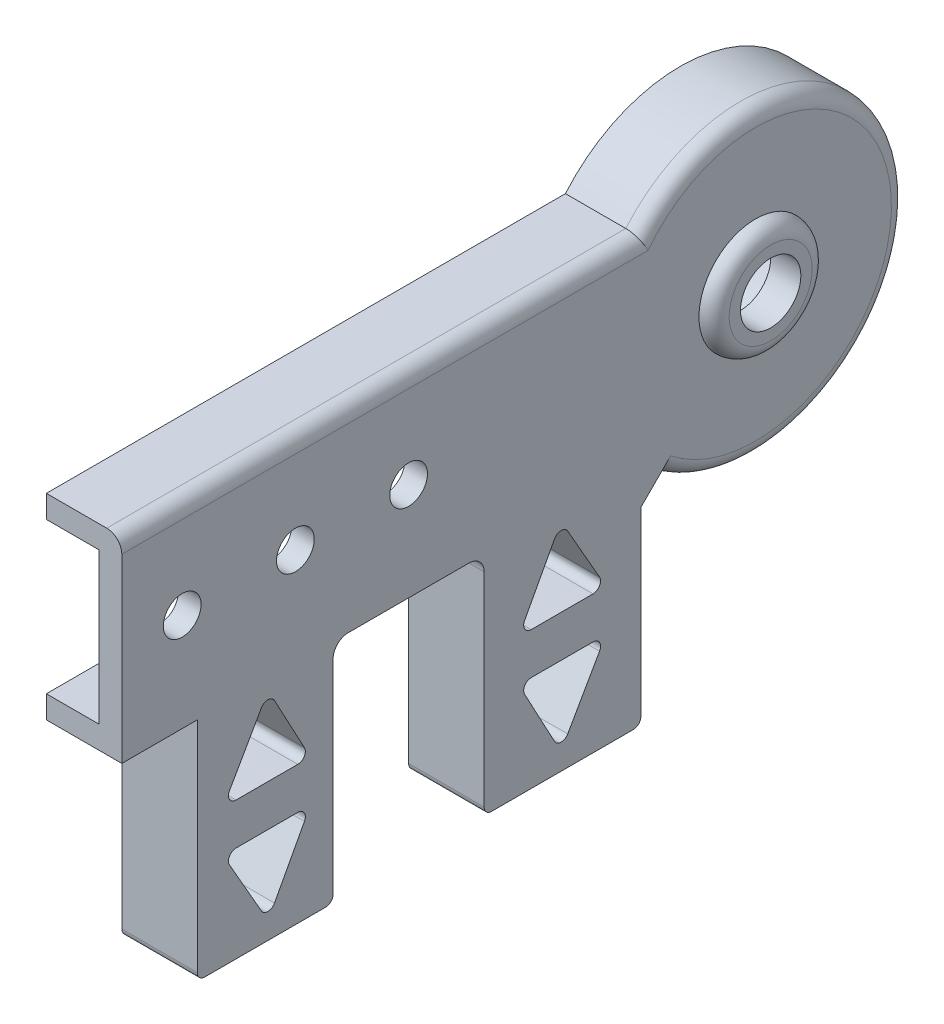
from build123d import *

# Parameters (mm, degrees)
SKETCH_1_R           = 20
SKETCH_1_W           = 63.973509934
SKETCH_1_H           = 26
EXTRUDE_1_DEPTH      = 10
SKETCH_2_W           = 45
SKETCH_2_H           = 20
CUT_EXTRUDE_1_DEPTH  = 7
SKETCH_3_R           = 10
CUT_EXTRUDE_2_DEPTH  = 8
SKETCH_4_R           = 4
CUT_EXTRUDE_3_DEPTH  = 7
SKETCH_6_W           = 10
SKETCH_6_H           = 8
EXTRUDE_2_DEPTH      = 15
CHAMFER_2_SIZE       = 5
EXTRUDE_3_DEPTH      = 20
SKETCH_8_W           = 10
SKETCH_8_H           = 12.77482578
EXTRUDE_4_DEPTH      = 15
SKETCH_9_W           = 7
SKETCH_9_H           = 20
EXTRUDE_5_DEPTH      = 10
SKETCH_10_W          = 7
SKETCH_10_H          = 20
EXTRUDE_6_DEPTH      = 7
SKETCH_11_W          = 10
SKETCH_11_H          = 15
CUT_EXTRUDE_5_DEPTH  = 60.88841868
SKETCH_12_R          = 10
SKETCH_12_W          = 48
SKETCH_12_H          = 20
EXTRUDE_7_DEPTH      = 10
SKETCH_13_R          = 10
CUT_EXTRUDE_6_DEPTH  = 8
SKETCH_14_R          = 4
CUT_EXTRUDE_7_DEPTH  = 8
SKETCH_15_W          = 48
SKETCH_15_H          = 20
CUT_EXTRUDE_8_DEPTH  = 7
SKETCH_16_W          = 10
SKETCH_16_H          = 18
SKETCH_16_H_2        = 20.77482578
EXTRUDE_8_DEPTH      = 15
CUT_EXTRUDE_9_DEPTH  = 15
FILLET_1_R           = 1
FILLET_2_R           = 2
SKETCH_18_R          = 7.5
SKETCH_18_R_2        = 4
EXTRUDE_9_DEPTH      = 2
FILLET_3_R           = 2
SKETCH_19_R          = 2.5
CUT_EXTRUDE_10_DEPTH = 3


# Some blends are built 0.0001 mm under size
with BuildPart() as part:
    # 草图1 → 凸台-拉伸1 (new body)
    with BuildSketch(Plane(origin=(0, 0, 0), x_dir=(0, 0, -1), z_dir=(1, 0, 0))):
        with Locations((31.986754967, 0)):
            Circle(SKETCH_1_R)
        Rectangle(SKETCH_1_W, SKETCH_1_H)
    extrude(amount=EXTRUDE_1_DEPTH)

    # 草图2 → 切除-拉伸1 (cut)
    with BuildSketch(Plane(origin=(10, 0, 0), x_dir=(0, 0, -1), z_dir=(1, 0, 0))):
        with Locations((-9.486754967, 0)):
            Rectangle(SKETCH_2_W, SKETCH_2_H)
    extrude(amount=-CUT_EXTRUDE_1_DEPTH, mode=Mode.SUBTRACT)

    # 草图3 → 切除-拉伸2 (cut)
    with BuildSketch(Plane(origin=(10, 0, 0), x_dir=(0, 0, -1), z_dir=(1, 0, 0))):
        with Locations((31.986754967, 0)):
            Circle(SKETCH_3_R)
    extrude(amount=-CUT_EXTRUDE_2_DEPTH, mode=Mode.SUBTRACT)

    # 草图4 → 切除-拉伸3 (cut)
    with BuildSketch(Plane(origin=(2, 0, 0), x_dir=(0, 0, -1), z_dir=(1, 0, 0))):
        with Locations((31.986754967, 0)):
            Circle(SKETCH_4_R)
    extrude(amount=-CUT_EXTRUDE_3_DEPTH, mode=Mode.SUBTRACT)

    # 草图6 → 凸台-拉伸2 (add)
    with BuildSketch(Plane.XZ.offset(13)):
        with Locations((5, -12.788070813)):
            Rectangle(SKETCH_6_W, SKETCH_6_H)
        with Locations((5, 27.986754967)):
            Rectangle(SKETCH_6_W, SKETCH_6_H)
    extrude(amount=EXTRUDE_2_DEPTH)

    # 倒角2
    # the kernel refuses this chamfer: 5, 3.546264764 mm, written as the material it adds along each edge
    with BuildSketch(Plane(origin=(10, -13, -16.788070813), x_dir=(0, -0.6995038411281902, -0.7146288381019251), z_dir=(-1, 0, 0))) as chamfer_2_piece_1:
        with BuildLine():
            Line((3.535736125, 0), (CHAMFER_2_SIZE * 0.699503841128, CHAMFER_2_SIZE * 0.714628838102))
            Line((CHAMFER_2_SIZE * 0.699503841128, CHAMFER_2_SIZE * 0.714628838102), (0, 0))
            ThreePointArc((0, 0), (1.768947181, 0.07828713), (3.535736125, 0))
        make_face()
    extrude(amount=10)

    # 草图7 → 凸台-拉伸3 (add)
    with BuildSketch(Plane.XY.offset(31.986754967)):
        Polygon((3, -10), (3, 10), (10, 10), (10, 13), (0, 13), (0, -28), (10, -28), (10, -10), align=None)
    extrude(amount=EXTRUDE_3_DEPTH)

    # 草图8 → 凸台-拉伸4 (add)
    with BuildSketch(Plane.XZ.offset(13)):
        with Locations((5, -2.400657923)):
            Rectangle(SKETCH_8_W, SKETCH_8_H)
    extrude(amount=EXTRUDE_4_DEPTH)

    # 草图9 → 凸台-拉伸5 (add)
    with BuildSketch(Plane.XY.offset(-13.013245033)):
        with Locations((6.5, 0)):
            Rectangle(SKETCH_9_W, SKETCH_9_H)
    extrude(amount=EXTRUDE_5_DEPTH)

    # 草图10 → 凸台-拉伸6 (add)
    with BuildSketch(Plane.XY.offset(-3.013245033)):
        with Locations((6.5, 0)):
            Rectangle(SKETCH_10_W, SKETCH_10_H)
    extrude(amount=EXTRUDE_6_DEPTH)

    # 草图11 → 切除-拉伸5 (cut, through all)
    with BuildSketch(Plane(origin=(10, 0, 0), x_dir=(0, 0, -1), z_dir=(1, 0, 0))):
        with Locations((-46.986754967, -20.5)):
            Rectangle(SKETCH_11_W, SKETCH_11_H)
    extrude(amount=-CUT_EXTRUDE_5_DEPTH, mode=Mode.SUBTRACT)

    # 草图12 → 凸台-拉伸7 (add)
    with BuildSketch(Plane(origin=(10, 0, 0), x_dir=(0, 0, -1), z_dir=(1, 0, 0))):
        with Locations((31.986754967, 0)):
            Circle(SKETCH_12_R)
        with Locations((-27.986754967, 0)):
            Rectangle(SKETCH_12_W, SKETCH_12_H)
    extrude(amount=-EXTRUDE_7_DEPTH)

    # 草图13 → 切除-拉伸6 (cut)
    with BuildSketch(Plane.ZY):
        with Locations((-31.986754967, 0)):
            Circle(SKETCH_13_R)
    extrude(amount=-CUT_EXTRUDE_6_DEPTH, mode=Mode.SUBTRACT)

    # 草图14 → 切除-拉伸7 (cut)
    with BuildSketch(Plane.ZY.offset(-8)):
        with Locations((-31.986754967, 0)):
            Circle(SKETCH_14_R)
    extrude(amount=-CUT_EXTRUDE_7_DEPTH, mode=Mode.SUBTRACT)

    # 草图15 → 切除-拉伸8 (cut)
    with BuildSketch(Plane.ZY):
        with Locations((27.986754967, 0)):
            Rectangle(SKETCH_15_W, SKETCH_15_H)
    extrude(amount=-CUT_EXTRUDE_8_DEPTH, mode=Mode.SUBTRACT)

    # 草图16 → 凸台-拉伸8 (add)
    with BuildSketch(Plane.XZ.offset(28)):
        with Locations((5, 32.986754967)):
            Rectangle(SKETCH_16_W, SKETCH_16_H)
        with Locations((5, -6.400657923)):
            Rectangle(SKETCH_16_W, SKETCH_16_H_2)
    extrude(amount=EXTRUDE_8_DEPTH)

    # 草图17 → 切除-拉伸9 (cut)
    with BuildSketch(Plane.ZY):
        Polygon((-0.590983184, -30.271873826), (-12.170144499, -30.271873826), (-6.199884933, -40.719828065), align=None)
        Polygon((-6.199884933, -14.312910757), (-0.590983184, -24.760864996), (-12.170144499, -24.760864996), align=None)
        Polygon((26.997900492, -24.760864996), (38.577061807, -24.760864996), (32.606802242, -14.312910757), align=None)
        Polygon((32.606802242, -40.719828065), (26.997900492, -30.271873826), (38.577061807, -30.271873826), align=None)
    extrude(amount=-CUT_EXTRUDE_9_DEPTH, mode=Mode.SUBTRACT)

    # 圆角1
    fillet_1_edges = [part.edges().sort_by_distance(p)[0] for p in [
        (5, -43, 41.986754967),
        (5, -43, 23.986754967),
        (5, -43, 3.986754967),
        (5, -43, -16.788070813),
        (5, -30.271873826, 38.577061807),
        (5, -40.719828065, 32.606802242),
        (5, -30.271873826, 26.997900492),
        (5, -24.760864996, 26.997900492),
        (5, -14.312910757, 32.606802242),
        (5, -24.760864996, 38.577061807),
        (5, -24.760864996, -12.170144499),
        (5, -14.312910757, -6.199884933),
        (5, -24.760864996, -0.590983184),
        (5, -30.271873826, -0.590983184),
        (5, -40.719828065, -6.199884933),
        (5, -30.271873826, -12.170144499),
    ]]
    fillet(fillet_1_edges, radius=FILLET_1_R)

    # 圆角2
    fillet_2_edges = [part.edges().sort_by_distance(p)[0] for p in [
        (5, -13, 3.986754967),
        (10, 13, 17.599342077),
        (5, -13, 23.986754967),
        (10, 1.767868063, -51.908467808),
    ]]
    fillet(fillet_2_edges, radius=FILLET_2_R)

    # 草图18 → 凸台-拉伸9 (add)
    with BuildSketch(Plane(origin=(10, 0, 0), x_dir=(0, 0, -1), z_dir=(1, 0, 0))):
        with Locations((31.986754967, 0)):
            Circle(SKETCH_18_R)
        with Locations(Location((31.986754967, 0, 0), (0, 0, 180))):
            Circle(SKETCH_18_R_2, mode=Mode.SUBTRACT)
    extrude(amount=EXTRUDE_9_DEPTH)

    # 圆角3
    fillet_3_edges = [part.edges().sort_by_distance(p)[0] for p in [
        (12, 0, -24.486754967),
    ]]
    fillet(fillet_3_edges, radius=FILLET_3_R - 0.0001)  # a hair under: the kernel refuses the full size

    # 草图19 → 切除-拉伸10 (cut)
    with BuildSketch(Plane.ZY.offset(-7)):
        with Locations((43.986754967, 0)):
            Circle(SKETCH_19_R)
        with Locations((28.986754967, 0)):
            Circle(SKETCH_19_R)
        with Locations((13.986754967, 0)):
            Circle(SKETCH_19_R)
    extrude(amount=-CUT_EXTRUDE_10_DEPTH, mode=Mode.SUBTRACT)


solid = part.part
